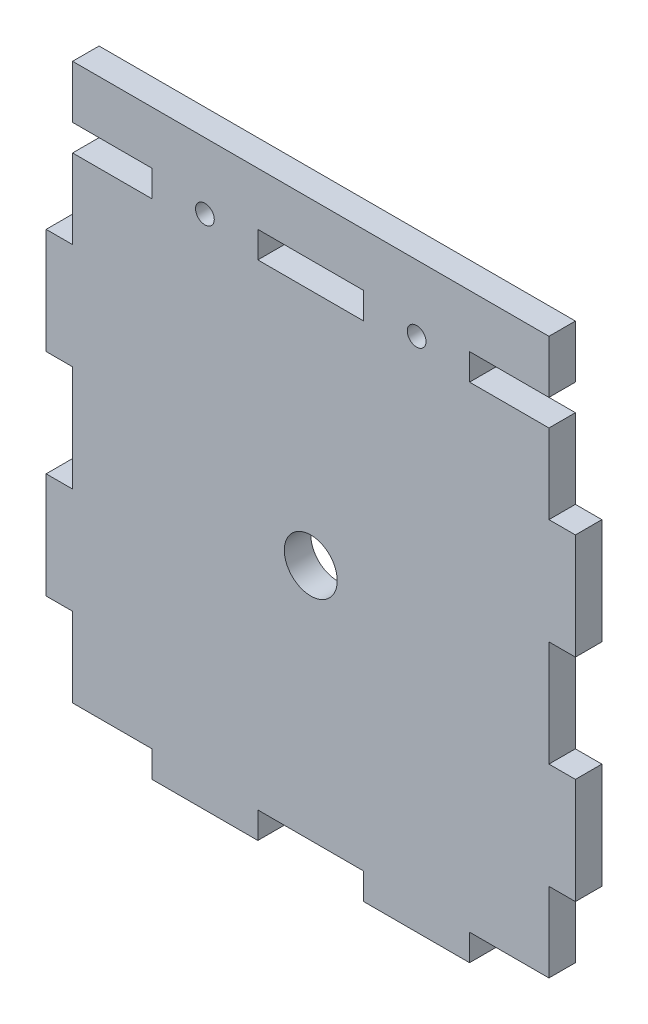
from build123d import *

# Parameters (mm, degrees)
SKETCH1_W                 = 127
SKETCH1_H                 = 139.7
BOSS_EXTRUDE1_DEPTH       = 6.35
SKETCH5_W                 = 6.35
SKETCH5_H                 = 25.4
CUT_EXTRUDE4_DEPTH        = 6.35
SKETCH6_W                 = 25.4
SKETCH6_H                 = 6.35
CUT_EXTRUDE5_DEPTH        = 6.35
LPATTERN5_COUNT           = 3
LPATTERN5_PITCH           = 50.8
LPATTERN5_COUNT_DIR2      = 2
LPATTERN5_PITCH_DIR2      = 120.65
LPATTERN6_COUNT           = 3
LPATTERN6_PITCH           = 50.8
LPATTERN6_COUNT_DIR2      = 2
LPATTERN6_PITCH_DIR2      = 120.65
SKETCH7_W                 = 6.35
SKETCH7_H                 = 19.05
SKETCH7_H_2               = 12.7
CUT_EXTRUDE6_DEPTH        = 6.35
F_8_CLEARANCE_HOLE1_D     = 4.4958
F_8_CLEARANCE_HOLE1_DEPTH = 10.16
F_8_CLEARANCE_HOLE1_TIP   = 1.350674586
SKETCH11_R                = 6.35
CUT_EXTRUDE7_DEPTH        = 7.62


with BuildPart() as part:
    # Sketch1 → Boss-Extrude1 (new body)
    with BuildSketch(Plane.XY):
        with Locations((63.5, 69.85)):
            Rectangle(SKETCH1_W, SKETCH1_H)
    extrude(amount=BOSS_EXTRUDE1_DEPTH)

    # Sketch5 → Cut-Extrude4 (cut)
    with BuildSketch(Plane.XY.offset(6.35)):
        with Locations((3.175, 12.7)):
            Rectangle(SKETCH5_W, SKETCH5_H)
    cut_extrude4 = extrude(amount=-CUT_EXTRUDE4_DEPTH, mode=Mode.SUBTRACT)

    # Sketch6 → Cut-Extrude5 (cut)
    with BuildSketch(Plane.XY.offset(6.35)):
        with Locations((12.7, 3.175)):
            Rectangle(SKETCH6_W, SKETCH6_H)
    cut_extrude5 = extrude(amount=-CUT_EXTRUDE5_DEPTH, mode=Mode.SUBTRACT)

    # LPattern5: Cut-Extrude4 3 × 2
    with Locations(*[(j * LPATTERN5_PITCH_DIR2, i * LPATTERN5_PITCH, 0) for i in range(LPATTERN5_COUNT) for j in range(LPATTERN5_COUNT_DIR2) if (i, j) != (0, 0)]):
        add(cut_extrude4, mode=Mode.SUBTRACT)

    # LPattern6: Cut-Extrude5 3 × 2
    with Locations(*[(i * LPATTERN6_PITCH, j * LPATTERN6_PITCH_DIR2, 0) for i in range(LPATTERN6_COUNT) for j in range(LPATTERN6_COUNT_DIR2) if (i, j) != (0, 0)]):
        add(cut_extrude5, mode=Mode.SUBTRACT)

    # Sketch7 → Cut-Extrude6 (cut)
    with BuildSketch(Plane.XY.offset(6.35)):
        with Locations((3.175, 130.175)):
            Rectangle(SKETCH7_W, SKETCH7_H)
        with Locations((123.825, 133.35)):
            Rectangle(SKETCH7_W, SKETCH7_H_2)
    extrude(amount=-CUT_EXTRUDE6_DEPTH, mode=Mode.SUBTRACT)

    # #8 Clearance Hole1
    with Locations(Plane.XY.offset(6.35)):
        with Locations((38.1, 123.825), (88.9, 123.825)):
            Hole(F_8_CLEARANCE_HOLE1_D / 2, depth=F_8_CLEARANCE_HOLE1_DEPTH)
            with Locations((0, 0, -(F_8_CLEARANCE_HOLE1_DEPTH + F_8_CLEARANCE_HOLE1_TIP / 2))):  # 118° drill point
                Cone(0, F_8_CLEARANCE_HOLE1_D / 2, F_8_CLEARANCE_HOLE1_TIP, mode=Mode.SUBTRACT)

    # Sketch11 → Cut-Extrude7 (cut)
    with BuildSketch(Plane.XY.offset(6.35)):
        with Locations((63.5, 63.5)):
            Circle(SKETCH11_R)
    extrude(amount=-CUT_EXTRUDE7_DEPTH, mode=Mode.SUBTRACT)


solid = part.part
